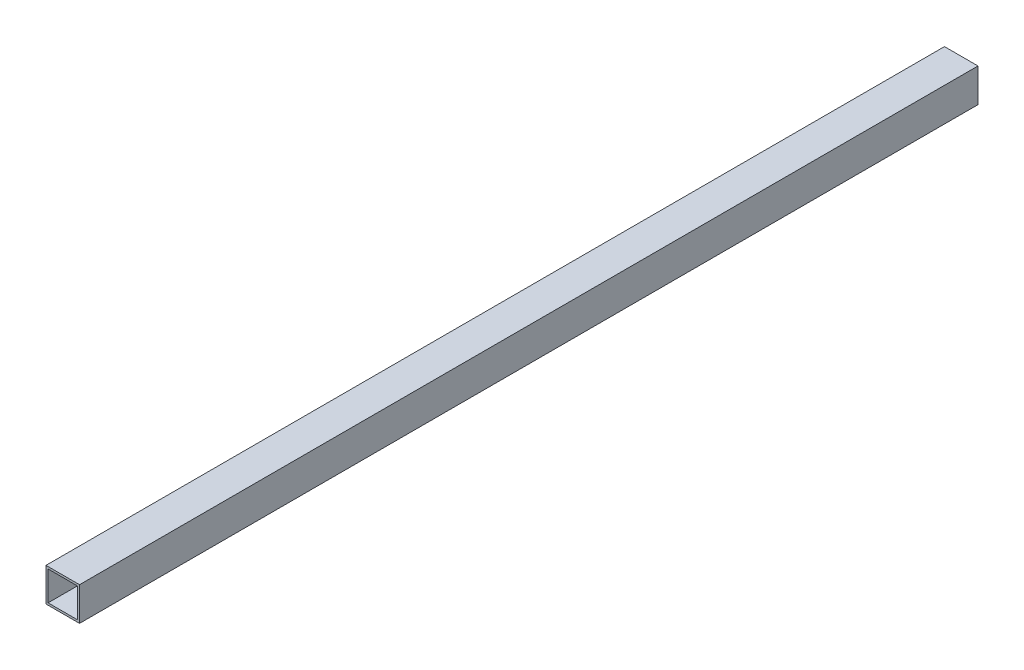
from build123d import *

# Parameters (mm, degrees)
SKETCH1_W           = 25.4
SKETCH1_H           = 25.4
BOSS_EXTRUDE1_DEPTH = 340.36
SKETCH2_W           = 22.225
SKETCH2_H           = 22.225
CUT_EXTRUDE1_DEPTH  = 681.956899077


with BuildPart() as part:
    # Sketch1 → Boss-Extrude1 (new, symmetric)
    with BuildSketch(Plane.XY):
        Rectangle(SKETCH1_W, SKETCH1_H)
    extrude(amount=BOSS_EXTRUDE1_DEPTH, both=True)

    # Sketch2 → Cut-Extrude1 (cut, through all)
    with BuildSketch(Plane.XY.offset(340.36)):
        Rectangle(SKETCH2_W, SKETCH2_H)
    extrude(amount=-CUT_EXTRUDE1_DEPTH, mode=Mode.SUBTRACT)


solid = part.part
